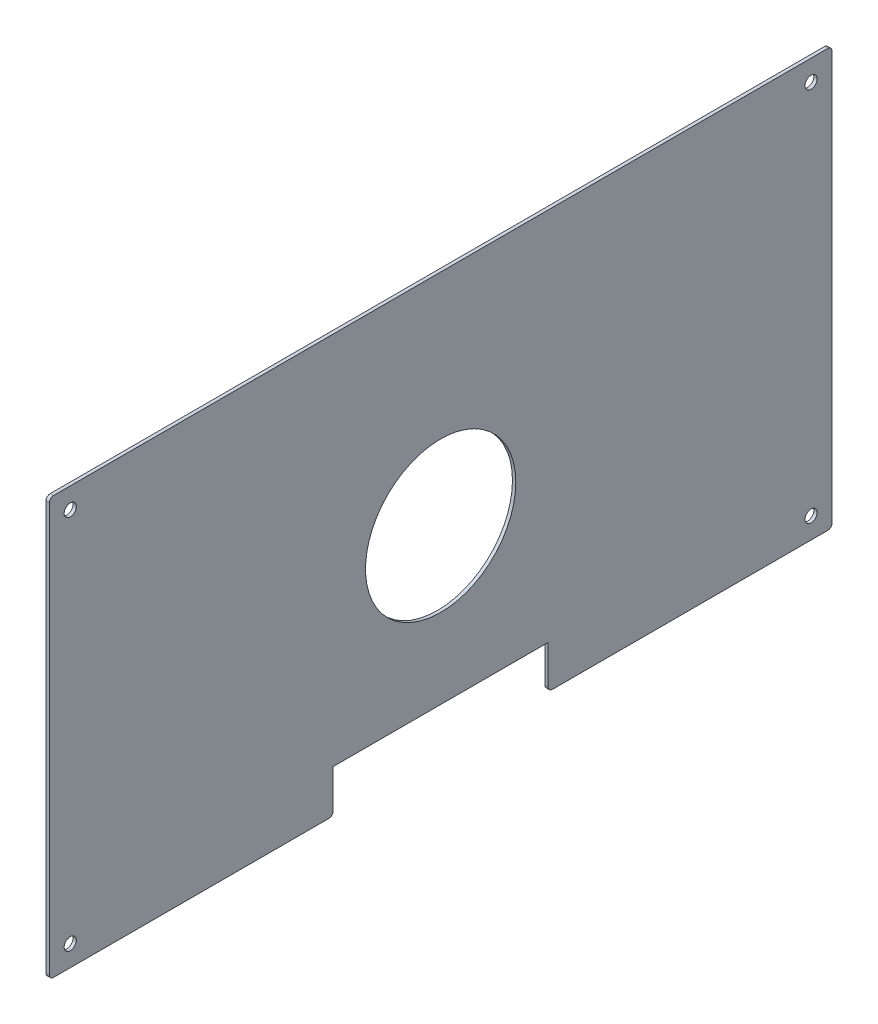
from build123d import *

# Parameters (mm, degrees)
SKETCH1_W            = 375
SKETCH1_H            = 200
SKETCH1_R            = 20
BASE_FLANGE1_DEPTH   = 1.5875
M5_CLEARANCE_HOLE1_D = 5.8
MIRROR2_COPY_1_D     = 5.8
FILLET1_R            = 2
FILLET2_R            = 2
FILLET3_R            = 2
FILLET4_R            = 2
SKETCH9_W            = 103
SKETCH9_H            = 20.5
CUT_EXTRUDE1_DEPTH   = 10
FILLET5_R            = 2
FILLET6_R            = 2
SKETCH10_R           = 20
BOSS_EXTRUDE1_DEPTH  = 1.5875
SKETCH11_R           = 36
CUT_EXTRUDE2_DEPTH   = 10


# Sheet-metal steps are written as plain solids
with BuildPart() as part:
    # Sketch1 → Base-Flange1 (new body)
    with BuildSketch(Plane(origin=(0, 0, 0), x_dir=(0, 0, -1), z_dir=(1, 0, 0))):
        Rectangle(SKETCH1_W, SKETCH1_H)
        Circle(SKETCH1_R, mode=Mode.SUBTRACT)
    extrude(amount=-BASE_FLANGE1_DEPTH)

    # M5 Clearance Hole1 (through all)
    with Locations(Plane.ZY.offset(1.5875)):
        with Locations((177.5, 90)):
            m5_clearance_hole1 = Hole(M5_CLEARANCE_HOLE1_D / 2)

    # Mirror1: M5 Clearance Hole1 across plane
    add(m5_clearance_hole1.mirror(Plane.XY), mode=Mode.SUBTRACT)

    # Mirror2: M5 Clearance Hole1 across plane
    add(m5_clearance_hole1.mirror(Plane.ZX), mode=Mode.SUBTRACT)

    # Mirror2 copy 1 (through all)
    with Locations(Plane(origin=(-1.5875, 0, 0), x_dir=(0, 0, -1), z_dir=(-1, 0, 0))):
        with Locations((177.5, 90)):
            Hole(MIRROR2_COPY_1_D / 2)

    # Fillet1
    fillet1_edges = [part.edges().sort_by_distance(p)[0] for p in [
        (-0.79375, -100, -187.5),
    ]]
    fillet(fillet1_edges, radius=FILLET1_R)

    # Fillet2
    fillet2_edges = [part.edges().sort_by_distance(p)[0] for p in [
        (-0.79375, 100, -187.5),
    ]]
    fillet(fillet2_edges, radius=FILLET2_R)

    # Fillet3
    fillet3_edges = [part.edges().sort_by_distance(p)[0] for p in [
        (-0.79375, 100, 187.5),
    ]]
    fillet(fillet3_edges, radius=FILLET3_R)

    # Fillet4
    fillet4_edges = [part.edges().sort_by_distance(p)[0] for p in [
        (-0.79375, -100, 187.5),
    ]]
    fillet(fillet4_edges, radius=FILLET4_R)

    # Sketch9 → Cut-Extrude1 (cut)
    with BuildSketch(Plane(origin=(0, 0, 0), x_dir=(0, 0, -1), z_dir=(1, 0, 0))):
        with Locations((0, -89.75)):
            Rectangle(SKETCH9_W, SKETCH9_H)
    extrude(amount=-CUT_EXTRUDE1_DEPTH, mode=Mode.SUBTRACT)

    # Fillet5
    fillet5_edges = [part.edges().sort_by_distance(p)[0] for p in [
        (-0.79375, -100, -51.5),
    ]]
    fillet(fillet5_edges, radius=FILLET5_R)

    # Fillet6
    fillet6_edges = [part.edges().sort_by_distance(p)[0] for p in [
        (-0.79375, -100, 51.5),
    ]]
    fillet(fillet6_edges, radius=FILLET6_R)

    # Sketch10 → Boss-Extrude1 (add)
    with BuildSketch(Plane(origin=(0, 0, 0), x_dir=(0, 0, -1), z_dir=(1, 0, 0))):
        Circle(SKETCH10_R)
    extrude(amount=-BOSS_EXTRUDE1_DEPTH)

    # Sketch11 → Cut-Extrude2 (cut)
    with BuildSketch(Plane(origin=(0, 0, 0), x_dir=(0, 0, -1), z_dir=(1, 0, 0))):
        with Locations((0, -5.28)):
            Circle(SKETCH11_R)
    extrude(amount=-CUT_EXTRUDE2_DEPTH, mode=Mode.SUBTRACT)


solid = part.part
